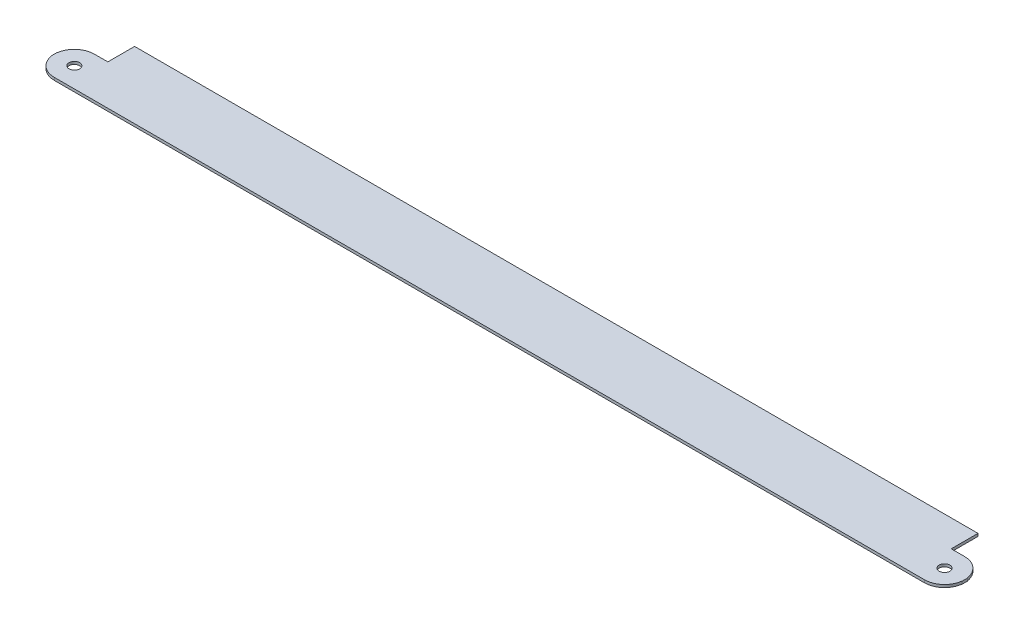
from build123d import *

# Parameters (mm, degrees)
SKETCH1_R           = 2
BOSS_EXTRUDE1_DEPTH = 1


with BuildPart() as part:
    # Sketch1 → Boss-Extrude1 (new body)
    with BuildSketch(Plane(origin=(0, 0, 0), x_dir=(1, 0, 0), z_dir=(0, 1, 0))):
        with BuildLine():
            Line((5, 7.5), (0, 7.5))
            ThreePointArc((0, 7.5), (-4.937104415, 5.645794895), (-7.433034374, 1))
            Line((-7.433034374, 1), (-7.5, 1))
            Line((-7.5, 1), (-7.5, -1))
            Line((-7.5, -1), (-7.433034374, -1))
            ThreePointArc((-7.433034374, -1), (-4.937104415, -5.645794895), (0, -7.5))
            Line((0, -7.5), (325, -7.5))
            ThreePointArc((325, -7.5), (329.937104415, -5.645794895), (332.433034374, -1))
            Line((332.433034374, -1), (332.5, -1))
            Line((332.5, -1), (332.5, 1))
            Line((332.5, 1), (332.433034374, 1))
            ThreePointArc((332.433034374, 1), (329.937104415, 5.645794895), (325, 7.5))
            Line((325, 7.5), (320, 7.5))
            Line((320, 7.5), (320, 17.5))
            Line((320, 17.5), (5, 17.5))
            Line((5, 17.5), (5, 7.5))
        make_face()
        Circle(SKETCH1_R, mode=Mode.SUBTRACT)
        with Locations((325, 0)):
            Circle(SKETCH1_R, mode=Mode.SUBTRACT)
    extrude(amount=BOSS_EXTRUDE1_DEPTH)


solid = part.part
